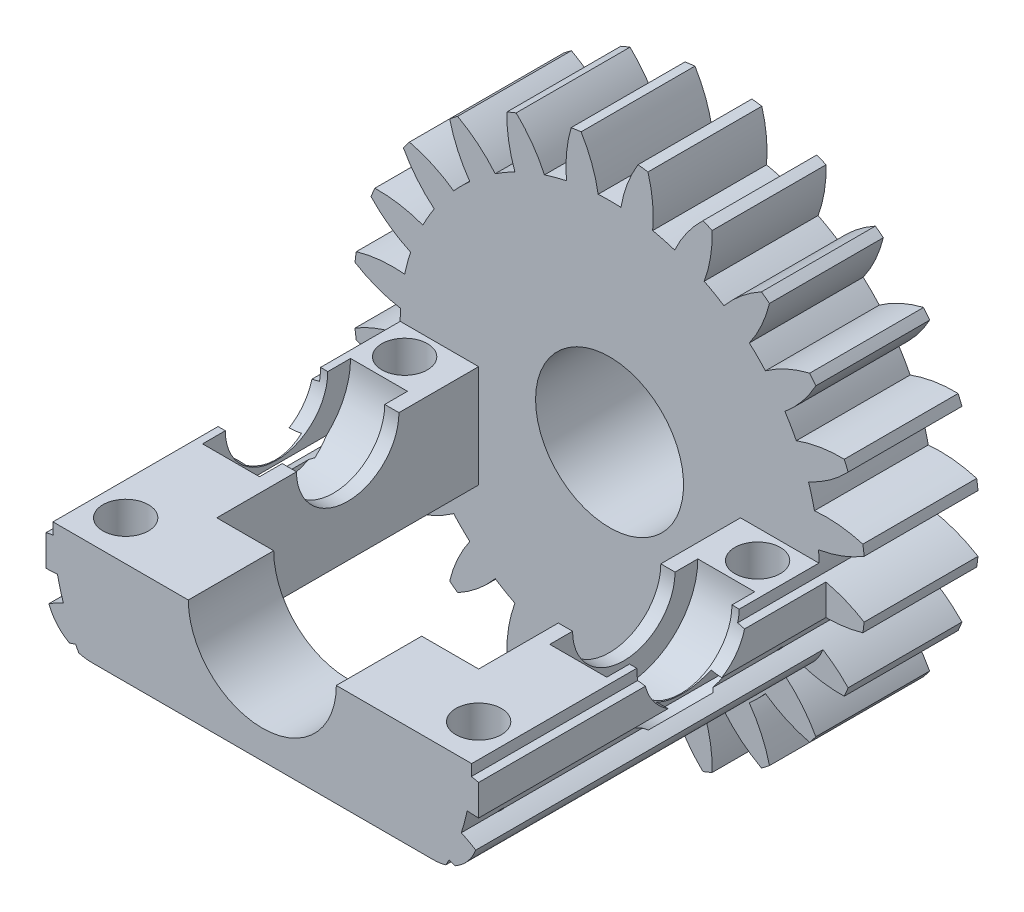
from build123d import *

# Parameters (mm, degrees)
BOSS_EXTRUDE1_DEPTH     = 9
SKETCH2_R               = 6.5
CUT_EXTRUDE1_DEPTH      = 2.5
SKETCH3_R               = 4.5
CUT_EXTRUDE2_DEPTH      = 29.337254631
SKETCH5_R               = 22.5
BOSS_EXTRUDE2_DEPTH     = 10
FILLET1_R               = 4
CUT_EXTRUDE3_DEPTH      = 45.280356819
CUT_EXTRUDE3_DEPTH_BACK = 45.280356819
SKETCH4_R               = 6.5
SKETCH6_R               = 2
CUT_EXTRUDE4_DEPTH      = 39.402473879
CUT_EXTRUDE5_DEPTH      = 57.024548263
CIRPATTERN1_COUNT       = 24


with BuildPart() as part:
    # Sketch1 → Boss-Extrude1 (new body)
    with BuildSketch(Plane(origin=(0, 0, 0), x_dir=(1, 0, 0), z_dir=(0, 1, 0))):
        Polygon((-19, 11.5), (-19, -19), (19, -19), (19, 11.5), (11.5, 11.5), (11.5, -11.5), (-11.5, -11.5), (-11.5, 11.5), align=None)
    extrude(amount=BOSS_EXTRUDE1_DEPTH)

    # Sketch2 → Cut-Extrude1 (cut, symmetric)
    with BuildSketch(Plane(origin=(15.25, 0, 0), x_dir=(0, 0, -1), z_dir=(1, 0, 0))):
        with Locations((0, 9)):
            Circle(SKETCH2_R)
    cut_extrude1 = extrude(amount=CUT_EXTRUDE1_DEPTH, both=True, mode=Mode.SUBTRACT)

    # Sketch3 → Cut-Extrude2 (cut, through all)
    with BuildSketch(Plane(origin=(0, 0, 0), x_dir=(0, 0, -1), z_dir=(1, 0, 0))):
        with Locations((0, 9)):
            Circle(SKETCH3_R)
    cut_extrude2 = extrude(amount=CUT_EXTRUDE2_DEPTH, mode=Mode.SUBTRACT)

    # Mirror1: Cut-Extrude1, Cut-Extrude2 across plane
    add(cut_extrude1.mirror(Plane(origin=(0, 0, 0), x_dir=(0, 0, 1), z_dir=(1, 0, 0))), mode=Mode.SUBTRACT)
    add(cut_extrude2.mirror(Plane(origin=(0, 0, 0), x_dir=(0, 0, 1), z_dir=(1, 0, 0))), mode=Mode.SUBTRACT)

    # Sketch5 → Boss-Extrude2 (add)
    with BuildSketch(Plane(origin=(0, 0, -11.5), x_dir=(-1, 0, 0), z_dir=(0, 0, -1))):
        with Locations((0, 9)):
            Circle(SKETCH5_R)
    extrude(amount=BOSS_EXTRUDE2_DEPTH)

    # Fillet1
    fillet1_edges = [part.edges().sort_by_distance(p)[0] for p in [
        (-19, 0, 3.75),
        (19, 0, 3.75),
    ]]
    fillet(fillet1_edges, radius=FILLET1_R)

    # Sketch4 → Cut-Extrude3 (cut, two sides: drawn at the far end of the back side and taken through both)
    with BuildSketch(Plane.XY.offset(-CUT_EXTRUDE3_DEPTH_BACK)):
        with Locations((0, 9)):
            Circle(SKETCH4_R)
    extrude(amount=CUT_EXTRUDE3_DEPTH + CUT_EXTRUDE3_DEPTH_BACK, mode=Mode.SUBTRACT)

    # Sketch6 → Cut-Extrude4 (cut, through all)
    with BuildSketch(Plane(origin=(0, 9, 0), x_dir=(1, 0, 0), z_dir=(0, 1, 0))):
        with Locations((-15.5, -15.5)):
            Circle(SKETCH6_R)
        with Locations((15.5, -15.5)):
            Circle(SKETCH6_R)
        with Locations((15.5, 9)):
            Circle(SKETCH6_R)
        with Locations((-15.5, 9)):
            Circle(SKETCH6_R)
    extrude(amount=-CUT_EXTRUDE4_DEPTH, mode=Mode.SUBTRACT)

    # Sketch7 → Cut-Extrude5 (cut, through all)
    with BuildSketch(Plane(origin=(0, 0, -21.5), x_dir=(-1, 0, 0), z_dir=(0, 0, -1))):
        with BuildLine():
            ThreePointArc((-2.5, 31.360679775), (-1.560980216, 29.431562194), (-1, 27.360679775))
            ThreePointArc((-1, 27.360679775), (0, 27.387891717), (1, 27.360679775))
            ThreePointArc((1, 27.360679775), (1.560980216, 29.431562194), (2.5, 31.360679775))
            ThreePointArc((2.5, 31.360679775), (0, 31.5), (-2.5, 31.360679775))
        make_face()
    cut_extrude5 = extrude(amount=-CUT_EXTRUDE5_DEPTH, mode=Mode.SUBTRACT)

    # CirPattern1: Cut-Extrude5 ×24 about axis
    cirpattern1_axis = Axis((0, 9, -21.5), (0, 0, 1))
    for i in range(1, CIRPATTERN1_COUNT):
        add(cut_extrude5.rotate(cirpattern1_axis, i * 360 / CIRPATTERN1_COUNT), mode=Mode.SUBTRACT)


solid = part.part
